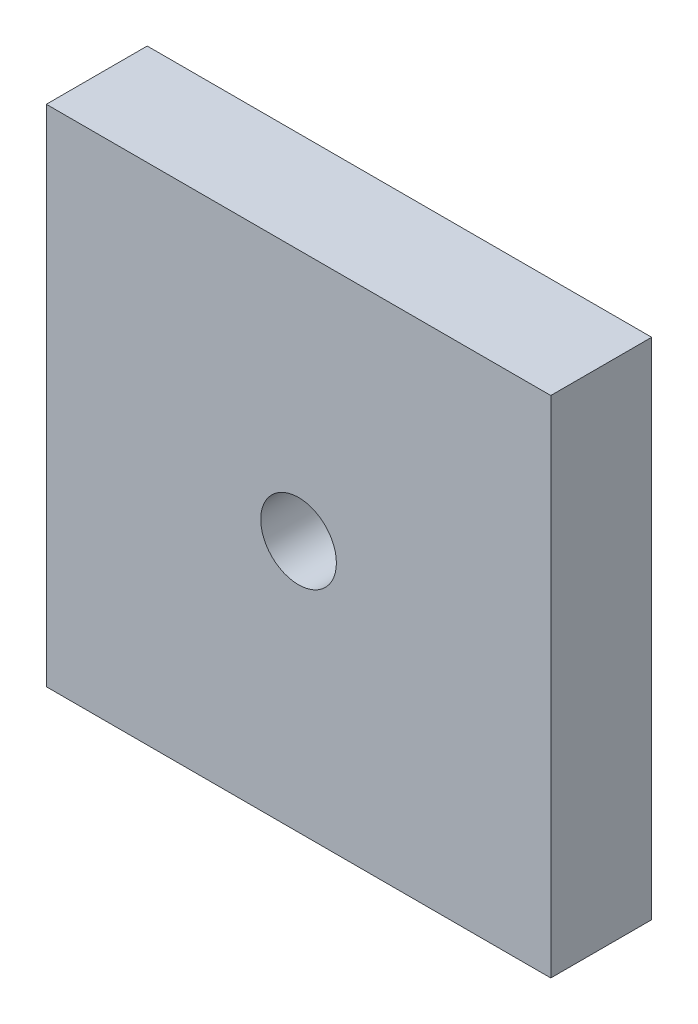
from build123d import *

# Parameters (mm, degrees)
SKETCH1_W           = 20
SKETCH1_H           = 20
SKETCH1_R           = 1.5
BOSS_EXTRUDE1_DEPTH = 4


with BuildPart() as part:
    # Sketch1 → Boss-Extrude1 (new body)
    with BuildSketch(Plane.XY):
        Rectangle(SKETCH1_W, SKETCH1_H)
        Circle(SKETCH1_R, mode=Mode.SUBTRACT)
    extrude(amount=BOSS_EXTRUDE1_DEPTH)


solid = part.part
